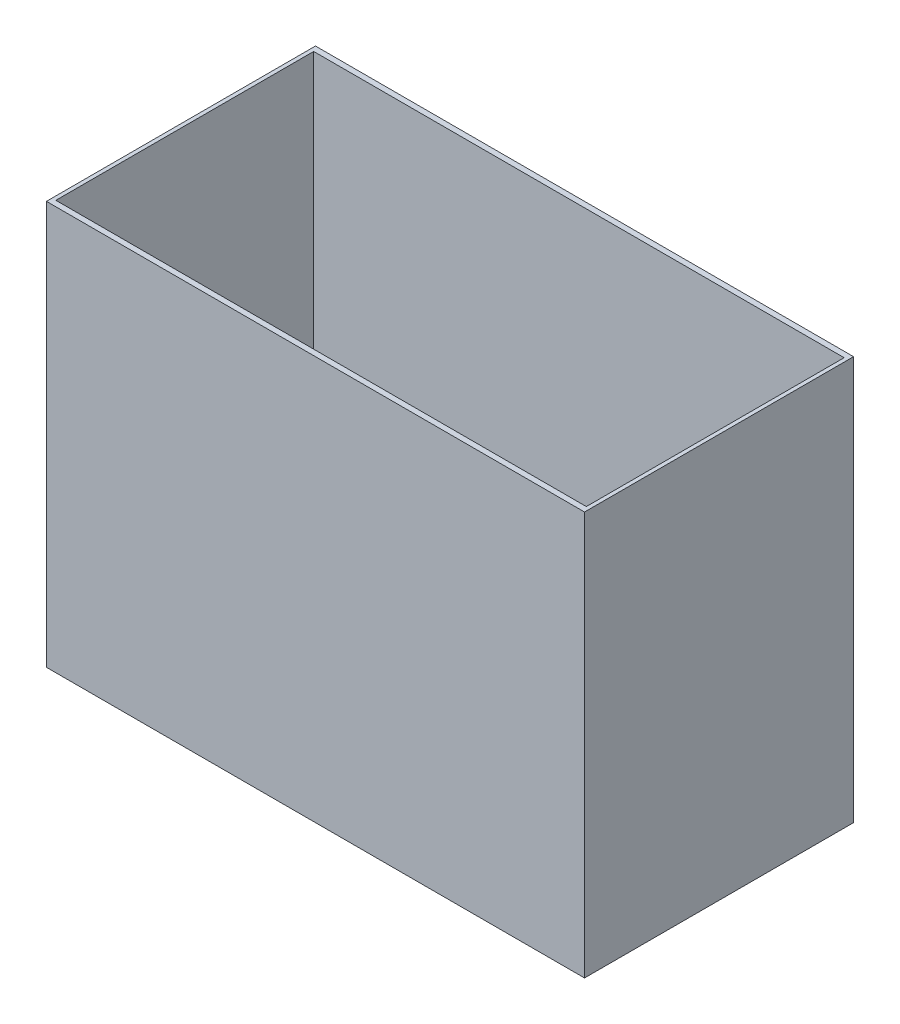
from build123d import *

# Parameters (mm, degrees)
SKETCH1_W           = 584.2
SKETCH1_H           = 279.4
BOSS_EXTRUDE1_DEPTH = 12.7
SKETCH3_W           = 609.6
SKETCH3_H           = 304.8
SKETCH3_W_2         = 600.964
SKETCH3_H_2         = 292.1
BOSS_EXTRUDE3_DEPTH = 457.2
SKETCH4_R           = 2.778125
CUT_EXTRUDE1_DEPTH  = 561.097357608
SKETCH6_R           = 6.35
CUT_EXTRUDE2_DEPTH  = 2.54
SKETCH7_R           = 2.778125
CUT_EXTRUDE3_DEPTH  = 561.097357608
SKETCH8_R           = 1.984375
CUT_EXTRUDE4_DEPTH  = 561.097357608
SKETCH9_R           = 6.35
CUT_EXTRUDE5_DEPTH  = 3.175
SKETCH11_W          = 50.8
SKETCH11_H          = 3.175
CUT_EXTRUDE6_DEPTH  = 571.228585744


with BuildPart() as part:
    # Sketch1 → Boss-Extrude1 (new body)
    with BuildSketch(Plane(origin=(0, 0, 0), x_dir=(1, 0, 0), z_dir=(0, 1, 0))):
        Rectangle(SKETCH1_W, SKETCH1_H)
    extrude(amount=BOSS_EXTRUDE1_DEPTH)

    # Sketch4 → Cut-Extrude1 (cut, through all)
    with BuildSketch(Plane(origin=(0, 12.7, 0), x_dir=(1, 0, 0), z_dir=(0, 1, 0))):
        with Locations((273.05, 120.65)):
            Circle(SKETCH4_R)
    cut_extrude1 = extrude(amount=-CUT_EXTRUDE1_DEPTH, mode=Mode.SUBTRACT)

    # Sketch6 → Cut-Extrude2 (cut)
    with BuildSketch(Plane.XZ):
        with Locations((273.05, -120.65)):
            Circle(SKETCH6_R)
    cut_extrude2 = extrude(amount=-CUT_EXTRUDE2_DEPTH, mode=Mode.SUBTRACT)

    # Mirror1: Cut-Extrude1, Cut-Extrude2 across plane
    add(cut_extrude1.mirror(Plane.XY), mode=Mode.SUBTRACT)
    add(cut_extrude2.mirror(Plane.XY), mode=Mode.SUBTRACT)

    # Sketch7 → Cut-Extrude3 (cut, through all)
    with BuildSketch(Plane(origin=(0, 12.7, 0), x_dir=(1, 0, 0), z_dir=(0, 1, 0))):
        with Locations((190.5, 0)):
            Circle(SKETCH7_R)
    extrude(amount=-CUT_EXTRUDE3_DEPTH, mode=Mode.SUBTRACT)

    # Sketch8 → Cut-Extrude4 (cut, through all)
    with BuildSketch(Plane(origin=(0, 12.7, 0), x_dir=(1, 0, 0), z_dir=(0, 1, 0))):
        with Locations((94.9, -12.8415)):
            Circle(SKETCH8_R)
        with Locations((146.1, -12.8415)):
            Circle(SKETCH8_R)
        with Locations((146.1, 12.8415)):
            Circle(SKETCH8_R)
        with Locations((94.9, 12.8415)):
            Circle(SKETCH8_R)
    extrude(amount=-CUT_EXTRUDE4_DEPTH, mode=Mode.SUBTRACT)

    # Sketch9 → Cut-Extrude5 (cut)
    with BuildSketch(Plane.XZ):
        with Locations((190.5, 0)):
            Circle(SKETCH9_R)
        with Locations((146.1, 12.8415)):
            Circle(SKETCH9_R)
        with Locations((94.9, 12.8415)):
            Circle(SKETCH9_R)
        with Locations((94.9, -12.8415)):
            Circle(SKETCH9_R)
        with Locations((146.1, -12.8415)):
            Circle(SKETCH9_R)
    extrude(amount=-CUT_EXTRUDE5_DEPTH, mode=Mode.SUBTRACT)

    # Sketch11 → Cut-Extrude6 (cut, through all)
    with BuildSketch(Plane.XZ):
        with Locations((190.5, 138.1125)):
            Rectangle(SKETCH11_W, SKETCH11_H)
    cut_extrude6 = extrude(amount=-CUT_EXTRUDE6_DEPTH, mode=Mode.SUBTRACT)

    # Mirror2: Cut-Extrude6 across plane
    add(cut_extrude6.mirror(Plane.XY), mode=Mode.SUBTRACT)


with BuildPart() as body_2:
    # Sketch3 → Boss-Extrude3 (new body)
    with BuildSketch(Plane(origin=(0, 0, 0), x_dir=(1, 0, 0), z_dir=(0, 1, 0))):
        Rectangle(SKETCH3_W, SKETCH3_H)
        Rectangle(SKETCH3_W_2, SKETCH3_H_2, mode=Mode.SUBTRACT)
    extrude(amount=BOSS_EXTRUDE3_DEPTH)


solid = Compound([part.part, body_2.part])
